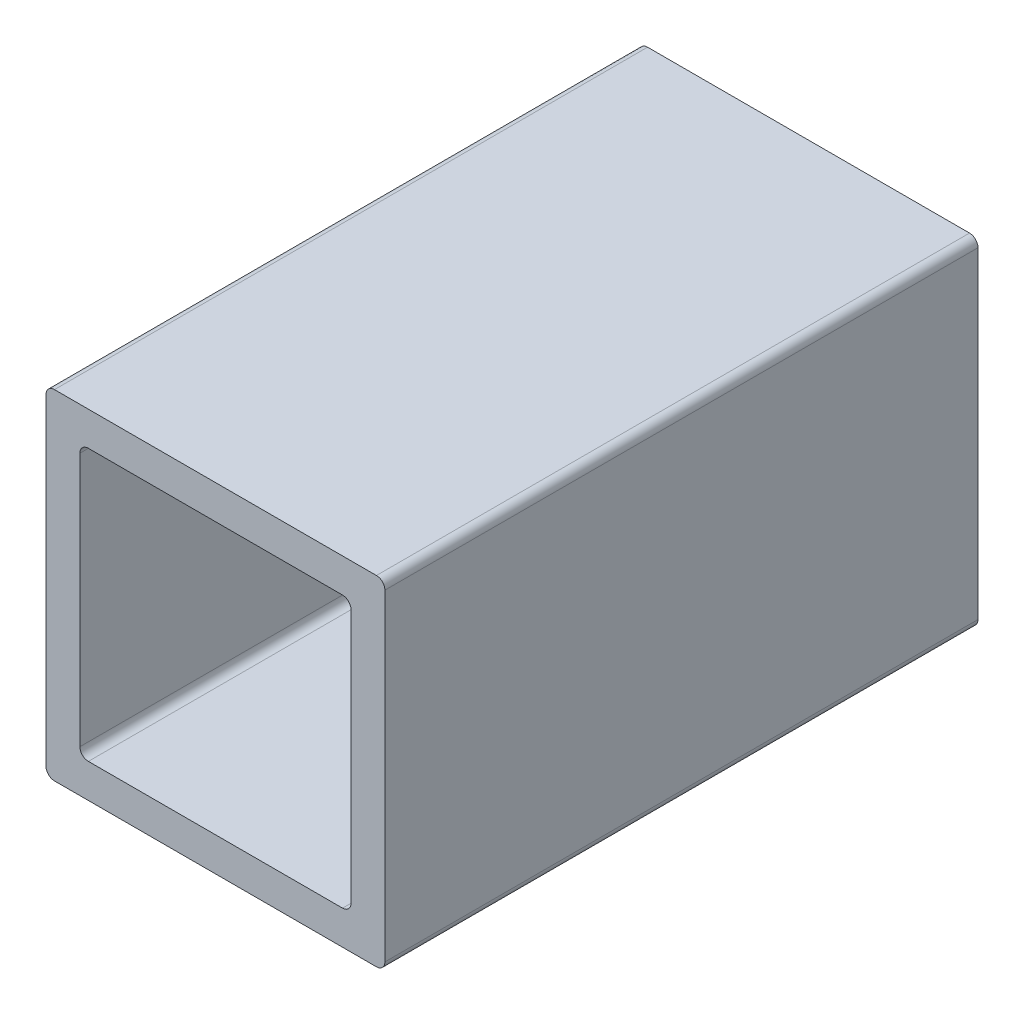
from build123d import *

# Parameters (mm, degrees)
ESQUISSE1_W        = 20
ESQUISSE1_H        = 20
BOSS_EXTRU_1_DEPTH = 35
COQUE2_T           = -2
CONG_1_R           = 0.5


with BuildPart() as part:
    # Esquisse1 → Boss.-Extru.1 (new body)
    with BuildSketch(Plane.XY):
        Rectangle(ESQUISSE1_W, ESQUISSE1_H)
    extrude(amount=BOSS_EXTRU_1_DEPTH)

    # Coque2
    coque2_openings = [part.faces().sort_by_distance(p)[0] for p in [
        (0, 0, 35),
    ]]
    offset(amount=COQUE2_T, openings=coque2_openings, kind=Kind.INTERSECTION)

    # Congé1
    cong_1_edges = [part.edges().sort_by_distance(p)[0] for p in [
        (8, 8, 18.5),
        (8, -8, 18.5),
        (-8, -8, 18.5),
        (-8, 8, 18.5),
        (-10, -10, 17.5),
        (10, -10, 17.5),
        (-10, 10, 17.5),
        (10, 10, 17.5),
    ]]
    fillet(cong_1_edges, radius=CONG_1_R)


solid = part.part
